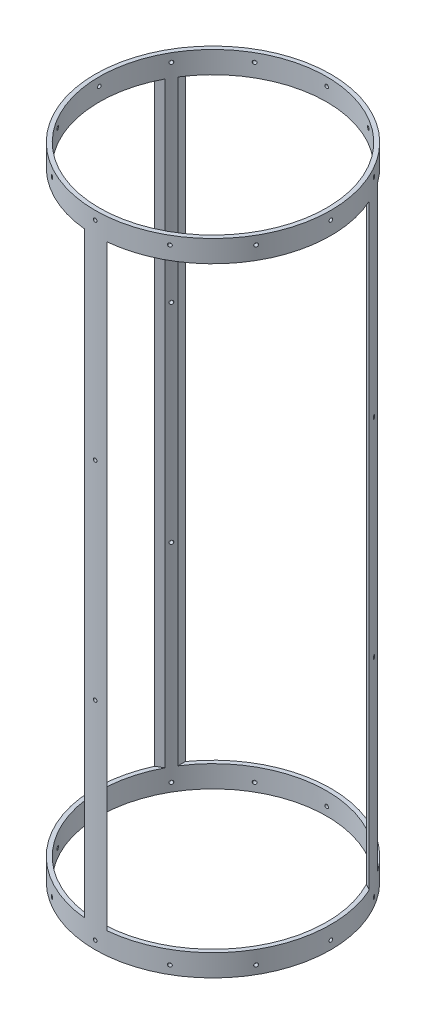
from build123d import *

# Parameters (mm, degrees)
SKETCH1_R                = 88.9
SKETCH1_R_2              = 85.725
BOSS_EXTRUDE1_DEPTH      = 241.427
CUT_EXTRUDE1_REACH       = 274.201
CUT_EXTRUDE1_END_RADIUS  = 88.9
SKETCH2_W                = 144.78
SKETCH2_H                = 449.834
CIRPATTERN1_COUNT        = 3
SKETCH4_R                = 1.35255
CUT_EXTRUDE3_DEPTH       = 15.24
CIRPATTERN3_COUNT        = 12
MIRROR1_COPY_1_SKETCH_R  = 1.35255
MIRROR1_COPY_1_DEPTH     = 15.24
MIRROR1_COPY_2_SKETCH_R  = 1.35255
MIRROR1_COPY_2_DEPTH     = 15.24
MIRROR1_COPY_3_SKETCH_R  = 1.35255
MIRROR1_COPY_3_DEPTH     = 15.24
MIRROR1_COPY_4_SKETCH_R  = 1.35255
MIRROR1_COPY_4_DEPTH     = 15.24
MIRROR1_COPY_5_SKETCH_R  = 1.35255
MIRROR1_COPY_5_DEPTH     = 15.24
MIRROR1_COPY_6_SKETCH_R  = 1.35255
MIRROR1_COPY_6_DEPTH     = 15.24
MIRROR1_COPY_7_SKETCH_R  = 1.35255
MIRROR1_COPY_7_DEPTH     = 15.24
MIRROR1_COPY_8_SKETCH_R  = 1.35255
MIRROR1_COPY_8_DEPTH     = 15.24
MIRROR1_COPY_9_SKETCH_R  = 1.35255
MIRROR1_COPY_9_DEPTH     = 15.24
MIRROR1_COPY_10_SKETCH_R = 1.35255
MIRROR1_COPY_10_DEPTH    = 15.24
MIRROR1_COPY_11_SKETCH_R = 1.35255
MIRROR1_COPY_11_DEPTH    = 15.24
SKETCH5_R                = 1.35255
CUT_EXTRUDE4_DEPTH       = 22.86
CIRPATTERN4_COUNT        = 3


with BuildPart() as part:
    # Sketch1 → Boss-Extrude1 (new, symmetric)
    with BuildSketch(Plane(origin=(0, 0, 0), x_dir=(1, 0, 0), z_dir=(0, 1, 0))):
        Circle(SKETCH1_R)
        Circle(SKETCH1_R_2, mode=Mode.SUBTRACT)
    extrude(amount=BOSS_EXTRUDE1_DEPTH, both=True)

    # Cut-Extrude1: up to this cylinder (the profile starts inside it)
    cut_extrude1_end = Plane(origin=(0, 0, 0), z_dir=(0, -1, 0)) * Cylinder(CUT_EXTRUDE1_END_RADIUS, 727.202, mode=Mode.PRIVATE)
    # Sketch2 → Cut-Extrude1 (cut, up to the surface)
    with BuildSketch(Plane.XY, mode=Mode.PRIVATE) as cut_extrude1_sk1:
        Rectangle(SKETCH2_W, SKETCH2_H)
    cut_extrude1_tool1 = extrude(cut_extrude1_sk1.sketch, amount=-CUT_EXTRUDE1_REACH, mode=Mode.PRIVATE) & cut_extrude1_end
    cut_extrude1 = cut_extrude1_tool1.solids().sort_by_distance((0, 0, 0))[0]
    add(cut_extrude1, mode=Mode.SUBTRACT)

    # CirPattern1: Cut-Extrude1 ×3 about axis
    cirpattern1_axis = Axis((0, 241.427, 0), (0, -1, 0))
    for i in range(1, CIRPATTERN1_COUNT):
        add(cut_extrude1.rotate(cirpattern1_axis, i * 360 / CIRPATTERN1_COUNT), mode=Mode.SUBTRACT)

    # Sketch4 → Cut-Extrude3 (cut)
    with BuildSketch(Plane(origin=(88.9, 0, 0), x_dir=(0, 0, -1), z_dir=(1, 0, 0))):
        with Locations((0, 235.077)):
            Circle(SKETCH4_R)
    cut_extrude3 = extrude(amount=-CUT_EXTRUDE3_DEPTH, mode=Mode.SUBTRACT)

    # CirPattern3: Cut-Extrude3 ×12 about axis
    cirpattern3_axis = Axis((0, 241.427, 0), (0, -1, 0))
    for i in range(1, CIRPATTERN3_COUNT):
        add(cut_extrude3.rotate(cirpattern3_axis, i * 360 / CIRPATTERN3_COUNT), mode=Mode.SUBTRACT)

    # Mirror1: Cut-Extrude3 across plane
    add(cut_extrude3.mirror(Plane.ZX), mode=Mode.SUBTRACT)

    # Mirror1 copy 1 sketch → Mirror1 copy 1 (cut)
    with BuildSketch(Plane(origin=(76.989658396, 0, 44.45), x_dir=(0.49999999999999994, 0, -0.8660254037844387), z_dir=(0.8660254037844387, 0, 0.49999999999999994))):
        with Locations((0, -235.077)):
            Circle(MIRROR1_COPY_1_SKETCH_R)
    extrude(amount=-MIRROR1_COPY_1_DEPTH, mode=Mode.SUBTRACT)

    # Mirror1 copy 2 sketch → Mirror1 copy 2 (cut)
    with BuildSketch(Plane(origin=(44.45, 0, 76.989658396), x_dir=(0.8660254037844386, 0, -0.5000000000000001), z_dir=(0.5000000000000001, 0, 0.8660254037844386))):
        with Locations((0, -235.077)):
            Circle(MIRROR1_COPY_2_SKETCH_R)
    extrude(amount=-MIRROR1_COPY_2_DEPTH, mode=Mode.SUBTRACT)

    # Mirror1 copy 3 sketch → Mirror1 copy 3 (cut)
    with BuildSketch(Plane.XY.offset(88.9)):
        with Locations((0, -235.077)):
            Circle(MIRROR1_COPY_3_SKETCH_R)
    extrude(amount=-MIRROR1_COPY_3_DEPTH, mode=Mode.SUBTRACT)

    # Mirror1 copy 4 sketch → Mirror1 copy 4 (cut)
    with BuildSketch(Plane(origin=(-44.45, 0, 76.989658396), x_dir=(0.8660254037844387, 0, 0.4999999999999998), z_dir=(-0.4999999999999998, 0, 0.8660254037844387))):
        with Locations((0, -235.077)):
            Circle(MIRROR1_COPY_4_SKETCH_R)
    extrude(amount=-MIRROR1_COPY_4_DEPTH, mode=Mode.SUBTRACT)

    # Mirror1 copy 5 sketch → Mirror1 copy 5 (cut)
    with BuildSketch(Plane(origin=(-76.989658396, 0, 44.45), x_dir=(0.49999999999999994, 0, 0.8660254037844387), z_dir=(-0.8660254037844387, 0, 0.49999999999999994))):
        with Locations((0, -235.077)):
            Circle(MIRROR1_COPY_5_SKETCH_R)
    extrude(amount=-MIRROR1_COPY_5_DEPTH, mode=Mode.SUBTRACT)

    # Mirror1 copy 6 sketch → Mirror1 copy 6 (cut)
    with BuildSketch(Plane.ZY.offset(88.9)):
        with Locations((0, -235.077)):
            Circle(MIRROR1_COPY_6_SKETCH_R)
    extrude(amount=-MIRROR1_COPY_6_DEPTH, mode=Mode.SUBTRACT)

    # Mirror1 copy 7 sketch → Mirror1 copy 7 (cut)
    with BuildSketch(Plane(origin=(-76.989658396, 0, -44.45), x_dir=(-0.5000000000000001, 0, 0.8660254037844386), z_dir=(-0.8660254037844386, 0, -0.5000000000000001))):
        with Locations((0, -235.077)):
            Circle(MIRROR1_COPY_7_SKETCH_R)
    extrude(amount=-MIRROR1_COPY_7_DEPTH, mode=Mode.SUBTRACT)

    # Mirror1 copy 8 sketch → Mirror1 copy 8 (cut)
    with BuildSketch(Plane(origin=(-44.45, 0, -76.989658396), x_dir=(-0.8660254037844384, 0, 0.5000000000000004), z_dir=(-0.5000000000000004, 0, -0.8660254037844384))):
        with Locations((0, -235.077)):
            Circle(MIRROR1_COPY_8_SKETCH_R)
    extrude(amount=-MIRROR1_COPY_8_DEPTH, mode=Mode.SUBTRACT)

    # Mirror1 copy 9 sketch → Mirror1 copy 9 (cut)
    with BuildSketch(Plane(origin=(0, 0, -88.9), x_dir=(-1, 0, 0), z_dir=(0, 0, -1))):
        with Locations((0, -235.077)):
            Circle(MIRROR1_COPY_9_SKETCH_R)
    extrude(amount=-MIRROR1_COPY_9_DEPTH, mode=Mode.SUBTRACT)

    # Mirror1 copy 10 sketch → Mirror1 copy 10 (cut)
    with BuildSketch(Plane(origin=(44.45, 0, -76.989658396), x_dir=(-0.8660254037844386, 0, -0.5000000000000001), z_dir=(0.5000000000000001, 0, -0.8660254037844386))):
        with Locations((0, -235.077)):
            Circle(MIRROR1_COPY_10_SKETCH_R)
    extrude(amount=-MIRROR1_COPY_10_DEPTH, mode=Mode.SUBTRACT)

    # Mirror1 copy 11 sketch → Mirror1 copy 11 (cut)
    with BuildSketch(Plane(origin=(76.989658396, 0, -44.45), x_dir=(-0.5000000000000004, 0, -0.8660254037844384), z_dir=(0.8660254037844384, 0, -0.5000000000000004))):
        with Locations((0, -235.077)):
            Circle(MIRROR1_COPY_11_SKETCH_R)
    extrude(amount=-MIRROR1_COPY_11_DEPTH, mode=Mode.SUBTRACT)

    # Sketch5 → Cut-Extrude4 (cut)
    with BuildSketch(Plane.XY.offset(88.9)):
        with Locations((0, 78.359)):
            Circle(SKETCH5_R)
        with Locations((0, -78.359)):
            Circle(SKETCH5_R)
    cut_extrude4 = extrude(amount=-CUT_EXTRUDE4_DEPTH, mode=Mode.SUBTRACT)

    # CirPattern4: Cut-Extrude4 ×3 about axis
    cirpattern4_axis = Axis((0, 241.427, 0), (0, -1, 0))
    for i in range(1, CIRPATTERN4_COUNT):
        add(cut_extrude4.rotate(cirpattern4_axis, i * 360 / CIRPATTERN4_COUNT), mode=Mode.SUBTRACT)


solid = part.part
